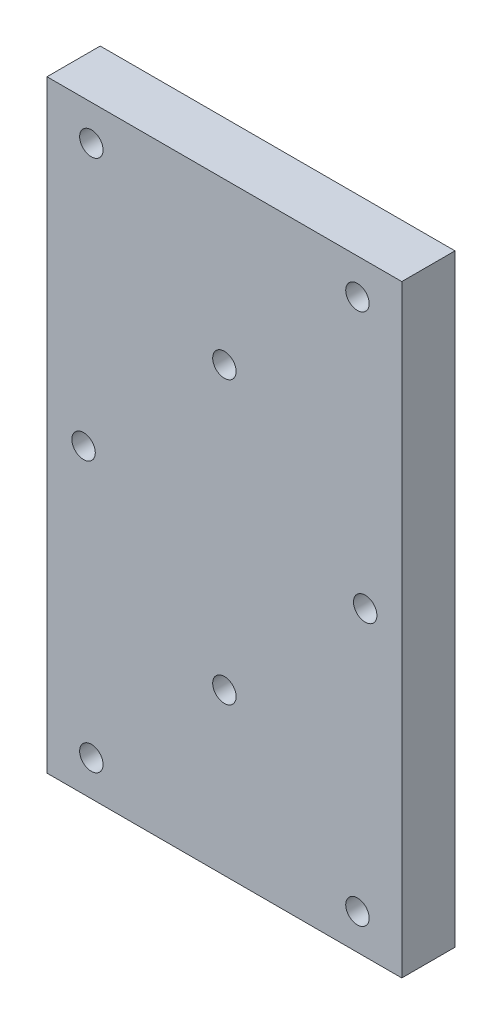
from build123d import *

# Parameters (mm, degrees)
SKETCH1_W           = 40
SKETCH1_H           = 68
SKETCH1_R           = 1.32
BOSS_EXTRUDE1_DEPTH = 6
SKETCH2_R           = 3.25
CUT_EXTRUDE1_DEPTH  = 4


with BuildPart() as part:
    # Sketch1 → Boss-Extrude1 (new body)
    with BuildSketch(Plane.XY):
        Rectangle(SKETCH1_W, SKETCH1_H)
        with Locations((0, -15.875)):
            Circle(SKETCH1_R, mode=Mode.SUBTRACT)
        with Locations((-15.875, 0)):
            Circle(SKETCH1_R, mode=Mode.SUBTRACT)
        with Locations((0, 15.875)):
            Circle(SKETCH1_R, mode=Mode.SUBTRACT)
        with Locations((15.875, 0)):
            Circle(SKETCH1_R, mode=Mode.SUBTRACT)
        with Locations((-15, 30)):
            Circle(SKETCH1_R, mode=Mode.SUBTRACT)
        with Locations((15, 30)):
            Circle(SKETCH1_R, mode=Mode.SUBTRACT)
        with Locations((15, -30)):
            Circle(SKETCH1_R, mode=Mode.SUBTRACT)
        with Locations((-15, -30)):
            Circle(SKETCH1_R, mode=Mode.SUBTRACT)
    extrude(amount=BOSS_EXTRUDE1_DEPTH)

    # Sketch2 → Cut-Extrude1 (cut)
    with BuildSketch(Plane(origin=(0, 0, 0), x_dir=(-1, 0, 0), z_dir=(0, 0, -1))):
        with Locations((0, 15.875)):
            Circle(SKETCH2_R)
        with Locations((15.875, 0)):
            Circle(SKETCH2_R)
        with Locations((0, -15.875)):
            Circle(SKETCH2_R)
        with Locations((-15.875, 0)):
            Circle(SKETCH2_R)
    extrude(amount=-CUT_EXTRUDE1_DEPTH, mode=Mode.SUBTRACT)


solid = part.part
